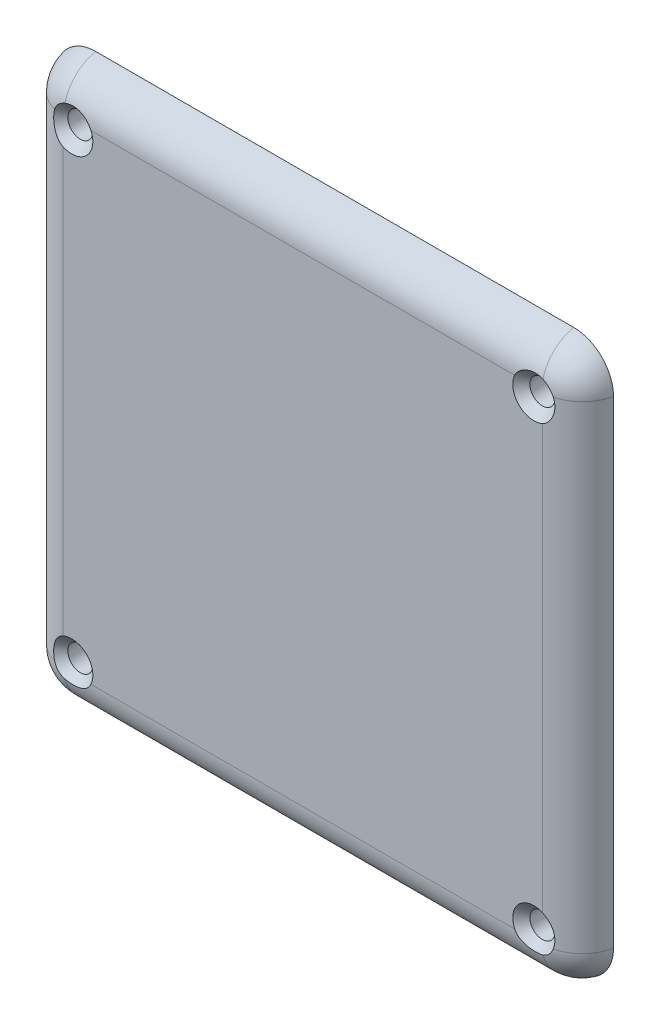
from build123d import *

# Parameters (mm, degrees)
BOSS_EXTRUDE1_DEPTH                                  = 5.08
FILLET1_R                                            = 6.35
SKETCH2_R                                            = 2.00025
CUT_EXTRUDE1_DEPTH                                   = 5.08
CUT_EXTRUDE2_DEPTH                                   = 1.524
CSK_FOR_M3_HEX_SOCKET_COUNTERSUNK_CAP_SC_D           = 3.4
CSK_FOR_M3_HEX_SOCKET_COUNTERSUNK_CAP_SC_CSINK_D     = 6.72
CSK_FOR_M3_HEX_SOCKET_COUNTERSUNK_CAP_SC_CSINK_ANGLE = 90


with BuildPart() as part:
    # Sketch1 → Boss-Extrude1 (new body)
    with BuildSketch(Plane.XY):
        with BuildLine():
            Line((-38.1, -44.45), (38.1, -44.45))
            ThreePointArc((38.1, -44.45), (42.590128061, -42.590128061), (44.45, -38.1))
            Line((44.45, -38.1), (44.45, 38.1))
            ThreePointArc((44.45, 38.1), (42.590128061, 42.590128061), (38.1, 44.45))
            Line((38.1, 44.45), (-38.1, 44.45))
            ThreePointArc((-38.1, 44.45), (-42.590128061, 42.590128061), (-44.45, 38.1))
            Line((-44.45, 38.1), (-44.45, -38.1))
            ThreePointArc((-44.45, -38.1), (-42.590128061, -42.590128061), (-38.1, -44.45))
        make_face()
    extrude(amount=BOSS_EXTRUDE1_DEPTH)

    # Fillet1
    # the kernel refuses this fillet: 6.35 mm, written as the material it takes off along each edge
    with BuildSketch(Plane(origin=(38.1, 44.45, 5.08), x_dir=(0, -1.563753501140824e-12, -1.0), z_dir=(-1, 0, 0)), Plane(origin=(44.45, -38.1, 5.08), x_dir=(-1.563753501140824e-12, 0, -1.0), z_dir=(0, 1, 0)), Plane(origin=(-38.1, -44.45, 5.08), x_dir=(0, 1.563753501140824e-12, -1.0), z_dir=(1, 0, 0)), Plane(origin=(-44.45, 38.1, 5.08), x_dir=(1.563753501140824e-12, 0, -1.0), z_dir=(0, -1, 0))) as fillet1_piece_1:
        with BuildLine():
            CenterArc((6.35, 6.221703947), FILLET1_R, 180, 78.463040967)
            Line((0, 6.221703947), (-0.127, 6.221703947))
            Line((-0.127, 6.221703947), (-0.127, 0))
            Line((-0.127, 0), (0, -0.127))
            ThreePointArc((0, -0.127), (2.54, -0.127), (5.0546, -0.124434079))
            Line((5.0546, -0.124434079), (5.08, 0))
        make_face()
    extrude(amount=76.2, mode=Mode.SUBTRACT)
    with BuildSketch(Plane(origin=(38.1, 38.1, 5.08), x_dir=(1, 0, 0), z_dir=(0, -1, 0))) as fillet1_piece_2:
        with BuildLine():
            CenterArc((0.128296053, -6.35), FILLET1_R, 11.536959033, 78.463040967)
            Line((0.128296053, 0), (0.128296053, 0.127))
            Line((0.128296053, 0.127), (6.35, 0.127))
            Line((6.35, 0.127), (6.477, 0))
            ThreePointArc((6.477, 0), (6.477, -2.54), (6.474434079, -5.0546))
            Line((6.474434079, -5.0546), (6.35, -5.08))
        make_face()
    revolve(axis=Axis((38.1, 38.1, 5.08), (0, 0, 1)), revolution_arc=90, mode=Mode.SUBTRACT)
    with BuildSketch(Plane(origin=(38.1, -38.1, 5.08), x_dir=(0, -1, 0), z_dir=(-1, 0, 0))) as fillet1_piece_3:
        with BuildLine():
            CenterArc((0.128296053, -6.35), FILLET1_R, 11.536959033, 78.463040967)
            Line((0.128296053, 0), (0.128296053, 0.127))
            Line((0.128296053, 0.127), (6.35, 0.127))
            Line((6.35, 0.127), (6.477, 0))
            ThreePointArc((6.477, 0), (6.477, -2.54), (6.474434079, -5.0546))
            Line((6.474434079, -5.0546), (6.35, -5.08))
        make_face()
    revolve(axis=Axis((38.1, -38.1, 5.08), (0, 0, 1)), revolution_arc=90, mode=Mode.SUBTRACT)
    with BuildSketch(Plane(origin=(-38.1, -38.1, 5.08), x_dir=(-1, 0, 0), z_dir=(0, 1, 0))) as fillet1_piece_4:
        with BuildLine():
            CenterArc((0.128296053, -6.35), FILLET1_R, 11.536959033, 78.463040967)
            Line((0.128296053, 0), (0.128296053, 0.127))
            Line((0.128296053, 0.127), (6.35, 0.127))
            Line((6.35, 0.127), (6.477, 0))
            ThreePointArc((6.477, 0), (6.477, -2.54), (6.474434079, -5.0546))
            Line((6.474434079, -5.0546), (6.35, -5.08))
        make_face()
    revolve(axis=Axis((-38.1, -38.1, 5.08), (0, 0, 1)), revolution_arc=90, mode=Mode.SUBTRACT)
    with BuildSketch(Plane(origin=(-38.1, 38.1, 5.08), x_dir=(0, 1, 0), z_dir=(1, 0, 0))) as fillet1_piece_5:
        with BuildLine():
            CenterArc((0.128296053, -6.35), FILLET1_R, 11.536959033, 78.463040967)
            Line((0.128296053, 0), (0.128296053, 0.127))
            Line((0.128296053, 0.127), (6.35, 0.127))
            Line((6.35, 0.127), (6.477, 0))
            ThreePointArc((6.477, 0), (6.477, -2.54), (6.474434079, -5.0546))
            Line((6.474434079, -5.0546), (6.35, -5.08))
        make_face()
    revolve(axis=Axis((-38.1, 38.1, 5.08), (0, 0, 1)), revolution_arc=90, mode=Mode.SUBTRACT)

    # Sketch2 → Cut-Extrude1 (cut)
    with BuildSketch(Plane.XY.offset(5.08)):
        with Locations(Location((-36.83, 36.83, 0), (0, 0, 44.351687845))):
            Circle(SKETCH2_R)
        with Locations(Location((36.83, 36.83, 0), (0, 0, 39.414098339))):
            Circle(SKETCH2_R)
        with Locations(Location((36.83, -36.83, 0), (0, 0, 320.585901644))):
            Circle(SKETCH2_R)
        with Locations(Location((-36.83, -36.83, 0), (0, 0, 315.648312155))):
            Circle(SKETCH2_R)
    extrude(amount=-CUT_EXTRUDE1_DEPTH, mode=Mode.SUBTRACT)

    # Sketch4 → Cut-Extrude2 (cut)
    with BuildSketch(Plane(origin=(0, 0, 0), x_dir=(-1, 0, 0), z_dir=(0, 0, -1))):
        Polygon((-9.779, 9.779), (-9.779, 34.925), (9.779, 34.925), (9.779, 9.779), (34.925, 9.779), (34.925, -9.779), (9.779, -9.779), (9.779, -34.925), (-9.779, -34.925), (-9.779, -9.779), (-34.925, -9.779), (-34.925, 9.779), align=None)
    extrude(amount=-CUT_EXTRUDE2_DEPTH, mode=Mode.SUBTRACT)

    # CSK for M3 Hex Socket Countersunk Cap Screw1 (through all)
    with Locations(Plane.XY.offset(5.08)):
        with Locations((-36.83, 36.83), (36.83, 36.83), (36.83, -36.83), (-36.83, -36.83)):
            CounterSinkHole(CSK_FOR_M3_HEX_SOCKET_COUNTERSUNK_CAP_SC_D / 2, CSK_FOR_M3_HEX_SOCKET_COUNTERSUNK_CAP_SC_CSINK_D / 2, counter_sink_angle=CSK_FOR_M3_HEX_SOCKET_COUNTERSUNK_CAP_SC_CSINK_ANGLE)


solid = part.part
